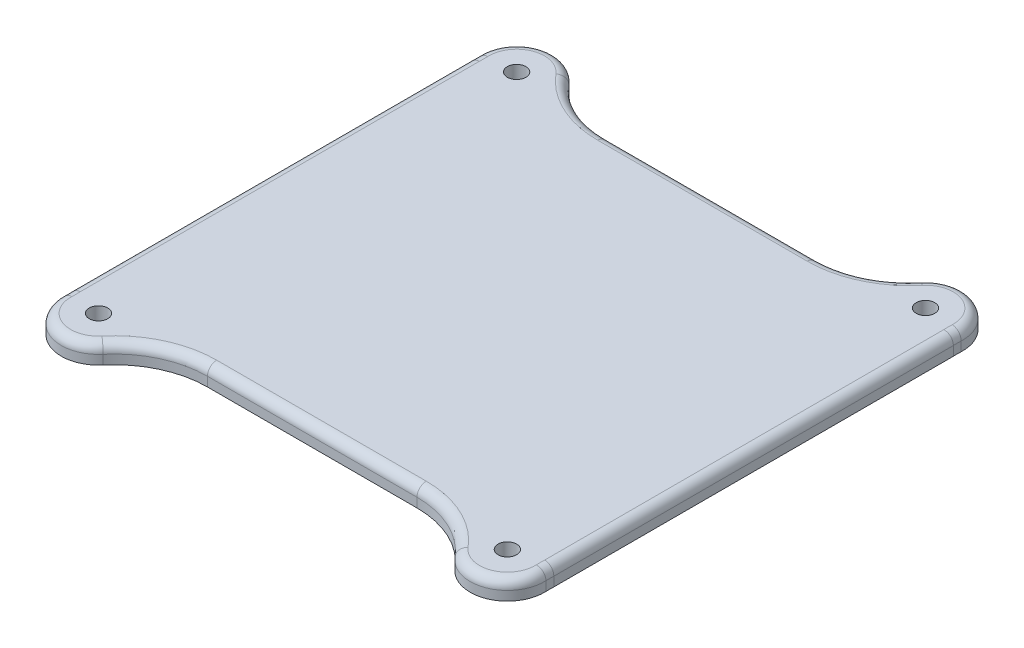
from build123d import *

# Parameters (mm, degrees)
SKETCH1_R           = 1
BOSS_EXTRUDE1_DEPTH = 2
FILLET1_R           = 1


with BuildPart() as part:
    # Sketch1 → Boss-Extrude1 (new body)
    with BuildSketch(Plane(origin=(0, 20, 0), x_dir=(1, 0, 0), z_dir=(0, 1, 0))):
        with BuildLine():
            Line((11.276194705, 21.5), (-11.276194705, 21.5))
            ThreePointArc((-11.276194705, 21.5), (-15.501965979, 22.436730328), (-18.93605563, 25.071428571))
            ThreePointArc((-18.93605563, 25.071428571), (-23.440763365, 26.231514562), (-25.99700152, 22.345148936))
            ThreePointArc((-25.99700152, 22.345148936), (-25.989568255, 21.922542776), (-26, 21.5))
            Line((-26, 21.5), (-26, -21.5))
            ThreePointArc((-26, -21.5), (-25.989568255, -21.922542776), (-25.99700152, -22.345148936))
            ThreePointArc((-25.99700152, -22.345148936), (-23.440763365, -26.231514562), (-18.93605563, -25.071428571))
            ThreePointArc((-18.93605563, -25.071428571), (-15.501965979, -22.436730328), (-11.276194705, -21.5))
            Line((-11.276194705, -21.5), (11.276194705, -21.5))
            ThreePointArc((11.276194705, -21.5), (15.501965979, -22.436730328), (18.93605563, -25.071428571))
            ThreePointArc((18.93605563, -25.071428571), (23.440763365, -26.231514562), (25.99700152, -22.345148936))
            ThreePointArc((25.99700152, -22.345148936), (25.989568255, -21.922542776), (26, -21.5))
            Line((26, -21.5), (26, 21.5))
            ThreePointArc((26, 21.5), (25.989568255, 21.922542776), (25.99700152, 22.345148936))
            ThreePointArc((25.99700152, 22.345148936), (23.440763365, 26.231514562), (18.93605563, 25.071428571))
            ThreePointArc((18.93605563, 25.071428571), (15.501965979, 22.436730328), (11.276194705, 21.5))
        make_face()
        with Locations(Location((-22, -22.5, 0), (0, 0, 270))):
            Circle(SKETCH1_R, mode=Mode.SUBTRACT)
        with Locations(Location((22, -22.5, 0), (0, 0, 270))):
            Circle(SKETCH1_R, mode=Mode.SUBTRACT)
        with Locations(Location((22, 22.5, 0), (0, 0, 270))):
            Circle(SKETCH1_R, mode=Mode.SUBTRACT)
        with Locations(Location((-22, 22.5, 0), (0, 0, 270))):
            Circle(SKETCH1_R, mode=Mode.SUBTRACT)
    extrude(amount=BOSS_EXTRUDE1_DEPTH)

    # Fillet1
    # the kernel refuses this fillet: 1 mm, written as the material it takes off along each edge
    with BuildSketch(Plane(origin=(-11.276194705, 22, -31.5), x_dir=(0, 0, 1), z_dir=(1, 0, 0))) as fillet1_piece_1:
        with BuildLine():
            CenterArc((10 + FILLET1_R, FILLET1_R), FILLET1_R, 180, 90)
            Line((10 + FILLET1_R, 0), (10, 0))
            Line((10, 0), (10, FILLET1_R))
        make_face()
    revolve(axis=Axis((-11.276194705, 22, -31.5), (0, -1, 0)), revolution_arc=49.994799115, mode=Mode.SUBTRACT)
    with BuildSketch(Plane(origin=(-22, 22, -22.5), x_dir=(0.7659860924831153, 0, -0.6428571428571425), z_dir=(0.6428571428571425, 0, 0.7659860924831153))) as fillet1_piece_2:
        with BuildLine():
            CenterArc((4 - FILLET1_R, -FILLET1_R), FILLET1_R, 0, 90)
            Line((4 - FILLET1_R, 0), (4, 0))
            Line((4, 0), (4, -FILLET1_R))
        make_face()
    revolve(axis=Axis((-22, 22, -22.5), (0, 1, 0)), revolution_arc=142.21343163, mode=Mode.SUBTRACT)
    with BuildSketch(Plane(origin=(-35.989505319, 22, -21.958021275), x_dir=(0.999250379905618, 0, -0.03871276609179466), z_dir=(-0.03871276609179466, 0, -0.999250379905618))) as fillet1_piece_3:
        with BuildLine():
            CenterArc((10 + FILLET1_R, FILLET1_R), FILLET1_R, 180, 90)
            Line((10 + FILLET1_R, 0), (10, 0))
            Line((10, 0), (10, FILLET1_R))
        make_face()
    revolve(axis=Axis((-35.989505319, 22, -21.958021275), (0, -1, 0)), revolution_arc=19.167781067, mode=Mode.SUBTRACT)
    with BuildSketch(Plane(origin=(-26, 22, -24), x_dir=(0, -1, 0), z_dir=(0, 0, 1)), Plane(origin=(26, 22, 24), x_dir=(0, -1, 0), z_dir=(0, 0, -1))) as fillet1_piece_4:
        with BuildLine():
            CenterArc((FILLET1_R, FILLET1_R), FILLET1_R, 180, 90)
            Line((0, FILLET1_R), (0, 0))
            Line((0, 0), (FILLET1_R, 0))
        make_face()
    extrude(amount=48, mode=Mode.SUBTRACT)
    with BuildSketch(Plane(origin=(-35.989505319, 22, 21.958021275), x_dir=(0.9565638665427638, 0, -0.2915228451163944), z_dir=(-0.2915228451163944, 0, -0.9565638665427638))) as fillet1_piece_5:
        with BuildLine():
            CenterArc((10 + FILLET1_R, FILLET1_R), FILLET1_R, 180, 90)
            Line((10 + FILLET1_R, 0), (10, 0))
            Line((10, 0), (10, FILLET1_R))
        make_face()
    revolve(axis=Axis((-35.989505319, 22, 21.958021275), (0, -1, 0)), revolution_arc=19.167781067, mode=Mode.SUBTRACT)
    with BuildSketch(Plane(origin=(-22, 22, 22.5), x_dir=(-0.9992503799056173, 0, -0.03871276609181696), z_dir=(0.03871276609181696, 0, -0.9992503799056173))) as fillet1_piece_6:
        with BuildLine():
            CenterArc((4 - FILLET1_R, -FILLET1_R), FILLET1_R, 0, 90)
            Line((4 - FILLET1_R, 0), (4, 0))
            Line((4, 0), (4, -FILLET1_R))
        make_face()
    revolve(axis=Axis((-22, 22, 22.5), (0, 1, 0)), revolution_arc=142.21343163, mode=Mode.SUBTRACT)
    with BuildSketch(Plane(origin=(-11.276194705, 22, 31.5), x_dir=(-0.7659860924831162, 0, -0.6428571428571414), z_dir=(-0.6428571428571414, 0, 0.7659860924831162))) as fillet1_piece_7:
        with BuildLine():
            CenterArc((10 + FILLET1_R, FILLET1_R), FILLET1_R, 180, 90)
            Line((10 + FILLET1_R, 0), (10, 0))
            Line((10, 0), (10, FILLET1_R))
        make_face()
    revolve(axis=Axis((-11.276194705, 22, 31.5), (0, -1, 0)), revolution_arc=49.994799115, mode=Mode.SUBTRACT)
    with BuildSketch(Plane(origin=(-11.276194705, 22, 21.5), x_dir=(0, -1, 0), z_dir=(1, 0, 0)), Plane(origin=(11.276194705, 22, -21.5), x_dir=(0, -1, 0), z_dir=(-1, 0, 0))) as fillet1_piece_8:
        with BuildLine():
            CenterArc((FILLET1_R, FILLET1_R), FILLET1_R, 180, 90)
            Line((0, FILLET1_R), (0, 0))
            Line((0, 0), (FILLET1_R, 0))
        make_face()
    extrude(amount=22.55238941, mode=Mode.SUBTRACT)
    with BuildSketch(Plane(origin=(11.276194705, 22, 31.5), x_dir=(0, 0, -1), z_dir=(-1, 0, 0))) as fillet1_piece_9:
        with BuildLine():
            CenterArc((10 + FILLET1_R, FILLET1_R), FILLET1_R, 180, 90)
            Line((10 + FILLET1_R, 0), (10, 0))
            Line((10, 0), (10, FILLET1_R))
        make_face()
    revolve(axis=Axis((11.276194705, 22, 31.5), (0, -1, 0)), revolution_arc=49.994799115, mode=Mode.SUBTRACT)
    with BuildSketch(Plane(origin=(22, 22, 22.5), x_dir=(-0.7659860924831153, 0, 0.6428571428571425), z_dir=(-0.6428571428571425, 0, -0.7659860924831153))) as fillet1_piece_10:
        with BuildLine():
            CenterArc((4 - FILLET1_R, -FILLET1_R), FILLET1_R, 0, 90)
            Line((4 - FILLET1_R, 0), (4, 0))
            Line((4, 0), (4, -FILLET1_R))
        make_face()
    revolve(axis=Axis((22, 22, 22.5), (0, 1, 0)), revolution_arc=142.21343163, mode=Mode.SUBTRACT)
    with BuildSketch(Plane(origin=(11.276194705, 22, -31.5), x_dir=(0.7659860924831151, 0, 0.6428571428571426), z_dir=(0.6428571428571426, 0, -0.7659860924831151))) as fillet1_piece_11:
        with BuildLine():
            CenterArc((10 + FILLET1_R, FILLET1_R), FILLET1_R, 180, 90)
            Line((10 + FILLET1_R, 0), (10, 0))
            Line((10, 0), (10, FILLET1_R))
        make_face()
    revolve(axis=Axis((11.276194705, 22, -31.5), (0, -1, 0)), revolution_arc=49.994799115, mode=Mode.SUBTRACT)
    with BuildSketch(Plane(origin=(35.989505319, 22, 21.958021275), x_dir=(-0.999250379905617, 0, 0.03871276609181962), z_dir=(0.03871276609181962, 0, 0.999250379905617))) as fillet1_piece_12:
        with BuildLine():
            CenterArc((10 + FILLET1_R, FILLET1_R), FILLET1_R, 180, 90)
            Line((10 + FILLET1_R, 0), (10, 0))
            Line((10, 0), (10, FILLET1_R))
        make_face()
    revolve(axis=Axis((35.989505319, 22, 21.958021275), (0, -1, 0)), revolution_arc=19.167781067, mode=Mode.SUBTRACT)
    with BuildSketch(Plane(origin=(35.989505319, 22, -21.958021275), x_dir=(-0.9565638665427474, 0, 0.2915228451164487), z_dir=(0.2915228451164487, 0, 0.9565638665427474))) as fillet1_piece_13:
        with BuildLine():
            CenterArc((10 + FILLET1_R, FILLET1_R), FILLET1_R, 180, 90)
            Line((10 + FILLET1_R, 0), (10, 0))
            Line((10, 0), (10, FILLET1_R))
        make_face()
    revolve(axis=Axis((35.989505319, 22, -21.958021275), (0, -1, 0)), revolution_arc=19.167781067, mode=Mode.SUBTRACT)
    with BuildSketch(Plane(origin=(22, 22, -22.5), x_dir=(0.9992503799056174, 0, 0.038712766091811596), z_dir=(-0.038712766091811596, 0, 0.9992503799056174))) as fillet1_piece_14:
        with BuildLine():
            CenterArc((4 - FILLET1_R, -FILLET1_R), FILLET1_R, 0, 90)
            Line((4 - FILLET1_R, 0), (4, 0))
            Line((4, 0), (4, -FILLET1_R))
        make_face()
    revolve(axis=Axis((22, 22, -22.5), (0, 1, 0)), revolution_arc=142.21343163, mode=Mode.SUBTRACT)


solid = part.part
